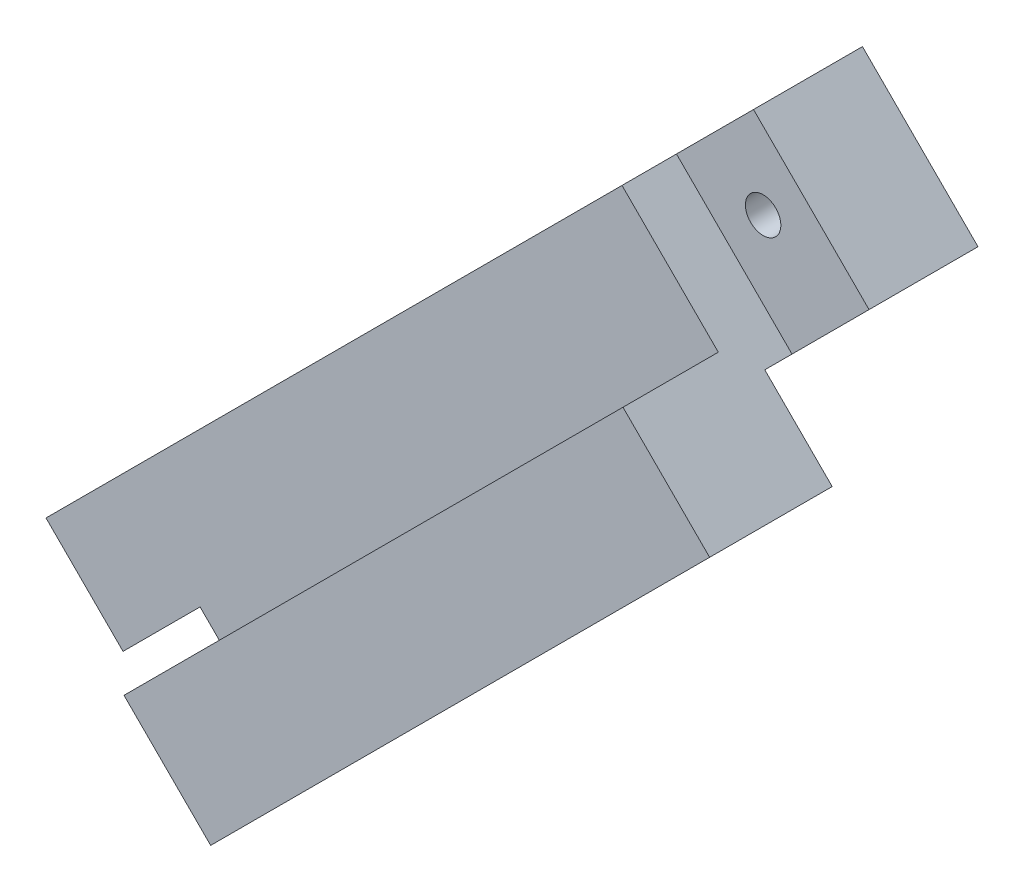
from build123d import *
from build123d.topology import SkipClean

# Parameters (mm, degrees)
STOCK_GOUX_START         = -16.954591703
STOCK_GOUX_LIKED_1_DEPTH = 33.909183406
SKETCH1_W                = 5.499999668
SKETCH1_H                = 5.499999668
BOSS_EXTRUDE1_DEPTH      = 33.909183
CUT_EXTRUDE1_DEPTH       = 0.2
SKETCH5_W                = 5.500000112
SKETCH5_H                = 4
CUT_EXTRUDE2_DEPTH       = 116.998760999
CUT_EXTRUDE3_REACH       = 131.039
SKETCH6_R                = 0.64999997
CIRPATTERN1_COUNT        = 2


# Read off the part's stored shape, not the designer's step: Stock-Goux Liked-1
with BuildPart() as part:
    # Stock-Goux Liked-1 outline → Stock-Goux Liked-1 (new body)
    with BuildSketch(Plane(origin=(0, 0, 0), x_dir=(0.7071067811865471, -0.707106781186548, -1.0381022375924514e-12), z_dir=(0.707106781186548, 0.707106781186547, 1.03810223759245e-12)).offset(STOCK_GOUX_START)):
        Polygon((113.704878, -109.20487811), (110.204877888, -109.20487811), (110.204877888, -104.204878204), (109.704877872, -104.204878204), (109.704877872, -109.704877872), (104.204878204, -109.704877872), (104.204878204, -110.204877888), (109.20487811, -110.204877888), (109.20487811, -113.704878), (113.704878, -113.704878), align=None)
    extrude(amount=STOCK_GOUX_LIKED_1_DEPTH)

    # Sketch1 → Boss-Extrude1 (add)
    with SkipClean():  # the faces are left unmerged after this step: merging them gives an invalid solid
        with BuildSketch(Plane(origin=(-11.988706765, -11.988706765, 0), x_dir=(0, 0, 1), z_dir=(-0.7071067811865476, -0.7071067811865476, -1.0381022375924498e-12))):
            with Locations((106.954878038, -106.954878038)):
                Rectangle(SKETCH1_W, SKETCH1_H)
        extrude(amount=-BOSS_EXTRUDE1_DEPTH)

    # Sketch4 → Cut-Extrude1 (cut)
    # profile 1 of 2: a face of its own
    with SkipClean():  # the faces are left unmerged after this step: merging them gives an invalid solid
        with BuildSketch(Plane(origin=(73.683976011, -73.683976011, 109.3690912), x_dir=(-0.577350269189024, -0.5773502691890293, -0.5773502691908239), z_dir=(0.7071067811865546, -0.7071067811865406, -7.406550393246722e-15))):
            Polygon((1.809420407, 5.9526292), (2.820688436, 5.237745386), (-0.821148503, 0.092362774), (-1.331234641, 0.453620787), (1.954432426, 5.095277437), (1.145418003, 5.667693303), align=None)
        # profile 2 of 2: a face of its own
        with BuildSketch(Plane(origin=(73.683976011, -73.683976011, 109.3690912), x_dir=(-0.577350269189024, -0.5773502691890293, -0.5773502691908239), z_dir=(0.7071067811865546, -0.7071067811865406, -7.406550393246722e-15))):
            with BuildLine():
                add(Edge.make_bspline(
                    [(2.877099219, 1.335109376), (2.935838558, 1.417405427), (3.049870438, 1.577168434), (3.226094966, 1.802117563), (3.397935378, 2.009052811), (3.565846799, 2.196717165), (3.731042214, 2.364759935), (3.892218805, 2.513489688), (4.049493585, 2.6446306), (4.206341025, 2.754179531), (4.360025947, 2.849477701), (4.513266986, 2.930884131), (4.665815664, 3.001483938), (4.818515166, 3.0586782), (4.970617605, 3.103726049), (5.122467787, 3.135794894), (5.273974853, 3.1545795), (5.424485375, 3.162398332), (5.57291168, 3.158649601), (5.71885612, 3.143489484), (5.861127958, 3.116280577), (6.000815508, 3.080299839), (6.135189962, 3.029311133), (6.267827501, 2.971265194), (6.395960204, 2.899842577), (6.477761121, 2.844757759), (6.518936158, 2.817030449)],
                    knots=[0, 0, 0, 0, 1.645926604, 3.195270974, 4.650990582, 6.024584171, 7.293755489, 8.485788563, 9.594173223, 10.624575106, 11.597800751, 12.536632912, 13.44787851, 14.332590146, 15.188862484, 16.028272991, 16.856251527, 17.671878837, 18.479816086, 19.271126229, 20.057755364, 20.836377498, 21.616069947, 22.394783881, 23.192003771, 24, 24, 24, 24], degree=3))
                add(Edge.make_bspline(
                    [(6.518936158, 2.817030449), (6.55976619, 2.787194518), (6.640619439, 2.728112222), (6.751575276, 2.627837993), (6.852736041, 2.520826461), (6.947411421, 2.408793466), (7.028861928, 2.287452494), (7.103669209, 2.160876743), (7.168780117, 2.027049302), (7.222899915, 1.885998413), (7.267901579, 1.739512987), (7.300866367, 1.587191132), (7.322801886, 1.429869211), (7.330695863, 1.26694766), (7.330109349, 1.099094482), (7.315823786, 0.925626884), (7.288049754, 0.747536935), (7.251766786, 0.563275675), (7.200579852, 0.372683439), (7.132420302, 0.175939832), (7.049730345, -0.028750132), (6.948143476, -0.239331033), (6.832538734, -0.457983193), (6.701011573, -0.684022575), (6.552211688, -0.916111082), (6.444401149, -1.071082575), (6.389188562, -1.150447515)],
                    knots=[0, 0, 0, 0, 0.816802234, 1.617464211, 2.412328798, 3.195799554, 3.984556322, 4.770779044, 5.57064894, 6.386329449, 7.210029482, 8.044686804, 8.902317584, 9.773878156, 10.678405193, 11.613358687, 12.583410326, 13.589949519, 14.647090142, 15.769568218, 16.952951381, 18.212671993, 19.546052618, 20.949315433, 22.437664922, 24, 24, 24, 24], degree=3))
                add(Edge.make_bspline(
                    [(6.389188562, -1.150447515), (6.332868819, -1.228410619), (6.222953274, -1.380566091), (6.053980888, -1.59680156), (5.886092947, -1.795129872), (5.720527442, -1.977104519), (5.555468389, -2.14060009), (5.392619894, -2.288332456), (5.229879441, -2.416533943), (5.06880285, -2.528231787), (4.908319086, -2.62376275), (4.750132346, -2.708320198), (4.591787049, -2.778366159), (4.43448342, -2.83591584), (4.277857668, -2.882112619), (4.121447774, -2.915750879), (3.965574172, -2.934147856), (3.811266823, -2.942458126), (3.659376547, -2.93720443), (3.510689745, -2.920194702), (3.36547389, -2.894056504), (3.223504099, -2.855347129), (3.084985381, -2.806224594), (2.95051219, -2.744153097), (2.819392507, -2.672081016), (2.735930058, -2.616047292), (2.693926142, -2.587847355)],
                    knots=[0, 0, 0, 0, 1.555964073, 3.036672929, 4.438544486, 5.759244319, 7.015609763, 8.196038705, 9.314565292, 10.364961386, 11.364978532, 12.334676732, 13.26524597, 14.163730662, 15.042916469, 15.905349198, 16.748578791, 17.579666054, 18.403330588, 19.204079274, 19.99928434, 20.788072044, 21.582240779, 22.374243664, 23.181810095, 24, 24, 24, 24], degree=3))
                add(Edge.make_bspline(
                    [(2.693926142, -2.587847355), (2.653972599, -2.558392707), (2.574601729, -2.49987872), (2.465975341, -2.401634599), (2.365605333, -2.297566017), (2.2736202, -2.1872728), (2.192619489, -2.068887343), (2.120885752, -1.944019679), (2.056991419, -1.813489721), (2.003797834, -1.675531189), (1.960019447, -1.532477258), (1.930351112, -1.383658885), (1.908865252, -1.230366615), (1.902666695, -1.072067221), (1.904295565, -0.908849471), (1.920445231, -0.741043703), (1.947114369, -0.568163649), (1.985744352, -0.389662384), (2.037667139, -0.203869884), (2.109148043, -0.010956547), (2.193927603, 0.192170439), (2.298441048, 0.403140358), (2.41709386, 0.624619201), (2.556318665, 0.8530354), (2.707928908, 1.093119466), (2.819610096, 1.252873979), (2.877099219, 1.335109376)],
                    knots=[0, 0, 0, 0, 0.808779551, 1.606704505, 2.384003051, 3.164613963, 3.944979997, 4.719198901, 5.510630197, 6.311633127, 7.127324821, 7.946144414, 8.782972344, 9.648016313, 10.525999108, 11.442197657, 12.393424347, 13.376370558, 14.417965243, 15.535316785, 16.727980085, 18.004753573, 19.371800586, 20.822810559, 22.364506719, 24, 24, 24, 24], degree=3))
            make_face()
            with BuildLine():
                add(Edge.make_bspline(
                    [(3.35665651, 0.981483574), (3.306978299, 0.911008481), (3.210677048, 0.774392459), (3.078907805, 0.570533382), (2.960189865, 0.377340166), (2.855654482, 0.194154463), (2.764740054, 0.020871626), (2.688020563, -0.142683987), (2.626604617, -0.296952862), (2.578871536, -0.44232507), (2.542700408, -0.580836662), (2.517352523, -0.715193163), (2.500264654, -0.845562566), (2.494109389, -0.973145552), (2.496347211, -1.096867933), (2.508033102, -1.217594791), (2.527765974, -1.33483755), (2.568655303, -1.483337821), (2.636042316, -1.657054286), (2.74538605, -1.843427475), (2.878111587, -2.00703341), (2.986845425, -2.092357104), (3.041191767, -2.135002804)],
                    knots=[0, 0, 0, 0, 1.477317626, 2.863781319, 4.158438436, 5.362400069, 6.477048567, 7.510710121, 8.456474969, 9.320360837, 10.130971237, 10.907558897, 11.661836949, 12.382033042, 13.094195176, 13.780270445, 14.458724783, 15.128447747, 16.416912985, 17.638070278, 18.819482119, 20, 20, 20, 20], degree=3))
                add(Edge.make_bspline(
                    [(3.041191767, -2.135002804), (3.099800739, -2.17244124), (3.216225144, -2.246811213), (3.413201595, -2.319023125), (3.622686973, -2.359717176), (3.805834636, -2.366647976), (3.95654946, -2.355929609), (4.071529863, -2.334291982), (4.187465506, -2.305679231), (4.303749507, -2.265403285), (4.421139745, -2.216249685), (4.537600801, -2.154256666), (4.65562294, -2.084375634), (4.732050575, -2.03119598), (4.771159716, -2.003983172)],
                    knots=[0, 0, 0, 0, 1.344638482, 2.671071166, 4.036222541, 5.467361339, 6.209241076, 6.960484297, 7.73186595, 8.521933696, 9.343145882, 10.195949186, 11.076840779, 12, 12, 12, 12], degree=3))
                add(Edge.make_bspline(
                    [(4.771159716, -2.003983172), (4.82003051, -1.9686221), (4.919374766, -1.896740325), (5.060918815, -1.774154816), (5.203980243, -1.643204395), (5.346378414, -1.50118221), (5.486261966, -1.346204267), (5.625768107, -1.181134288), (5.765465845, -1.005346674), (5.854185711, -0.881592057), (5.899454988, -0.818446313)],
                    knots=[0, 0, 0, 0, 0.88015219, 1.789168058, 2.730971114, 3.71133991, 4.723490847, 5.777526881, 6.865983973, 8, 8, 8, 8], degree=3))
                add(Edge.make_bspline(
                    [(5.899454988, -0.818446313), (5.943440103, -0.754631373), (6.029543374, -0.629710132), (6.150227485, -0.443464789), (6.259152206, -0.262044693), (6.355718777, -0.085418135), (6.441234167, 0.086343364), (6.515300272, 0.253071347), (6.577842064, 0.414764781), (6.629318725, 0.571342113), (6.668108931, 0.723318751), (6.699830384, 0.869038513), (6.718294541, 1.009907895), (6.729255617, 1.144940449), (6.729305449, 1.27510735), (6.719388817, 1.399803316), (6.699117623, 1.519074129), (6.658532604, 1.667727811), (6.589724745, 1.839773408), (6.485308774, 2.027436778), (6.35071278, 2.187039301), (6.243987251, 2.272131395), (6.190751062, 2.314576523)],
                    knots=[0, 0, 0, 0, 1.329008706, 2.601607309, 3.804917726, 4.956779838, 6.052592714, 7.094265147, 8.08401922, 9.024445114, 9.918561811, 10.772732897, 11.579936426, 12.352846219, 13.094480438, 13.809401199, 14.495531423, 15.16575916, 16.448433362, 17.663221731, 18.834382256, 20, 20, 20, 20], degree=3))
                add(Edge.make_bspline(
                    [(6.190751062, 2.314576523), (6.132614295, 2.352127809), (6.016155599, 2.427349979), (5.81770787, 2.498184297), (5.606353968, 2.539715843), (5.382213361, 2.546580658), (5.149380752, 2.518724602), (4.913135228, 2.450090337), (4.677174981, 2.338776518), (4.482367978, 2.216674302), (4.323401293, 2.097053878), (4.19971893, 1.986444491), (4.06914087, 1.861579711), (3.934519899, 1.718976231), (3.796468021, 1.558053158), (3.652668391, 1.381505856), (3.505185008, 1.187646731), (3.407224802, 1.051674271), (3.35665651, 0.981483574)],
                    knots=[0, 0, 0, 0, 0.946200866, 1.895415318, 2.86683806, 3.890638819, 4.95642944, 6.069637659, 7.24797886, 8.522380418, 9.215378954, 9.973389102, 10.795730965, 11.692243744, 12.6608267, 13.702269491, 14.813882584, 16, 16, 16, 16], degree=3))
            make_face(mode=Mode.SUBTRACT)
        extrude(amount=CUT_EXTRUDE1_DEPTH, mode=Mode.SUBTRACT)

    # Sketch5 → Cut-Extrude2 (cut, symmetric)
    with BuildSketch(Plane(origin=(77.926616474, -77.926616474, 0), x_dir=(0, 0, -1), z_dir=(0.7071067811865549, -0.7071067811865401, -7.502698527565898e-15))):
        with Locations((-110.954877944, 14.954591703)):
            Rectangle(SKETCH5_W, SKETCH5_H)
    cut_extrude2 = extrude(amount=CUT_EXTRUDE2_DEPTH, both=True, mode=Mode.SUBTRACT)

    # Sketch6 → Cut-Extrude3 (cut, up to next)
    with BuildSketch(Plane.XY.offset(108.204877888), mode=Mode.PRIVATE) as cut_extrude3_sk1:
        with Locations((86.026236134, -64.877249727)):
            Circle(SKETCH6_R)
    cut_extrude3_tool1 = extrude(cut_extrude3_sk1.sketch, amount=-CUT_EXTRUDE3_REACH, mode=Mode.PRIVATE) & part.part
    cut_extrude3 = cut_extrude3_tool1.solids().sort_by_distance((86.026236, -64.87725, 108.204878))[0]
    add(cut_extrude3, mode=Mode.SUBTRACT)

    # CirPattern1: Cut-Extrude2, Cut-Extrude3 ×2 about axis
    cirpattern1_axis = Axis((0, 0, 0), (0.49999999999973677, -0.5000000000002639, 0.7071067811865471))
    add([cut_extrude2.rotate(cirpattern1_axis, i * 360 / CIRPATTERN1_COUNT) for i in range(1, CIRPATTERN1_COUNT)], mode=Mode.SUBTRACT)
    add([cut_extrude3.rotate(cirpattern1_axis, i * 360 / CIRPATTERN1_COUNT) for i in range(1, CIRPATTERN1_COUNT)], mode=Mode.SUBTRACT)


solid = part.part
